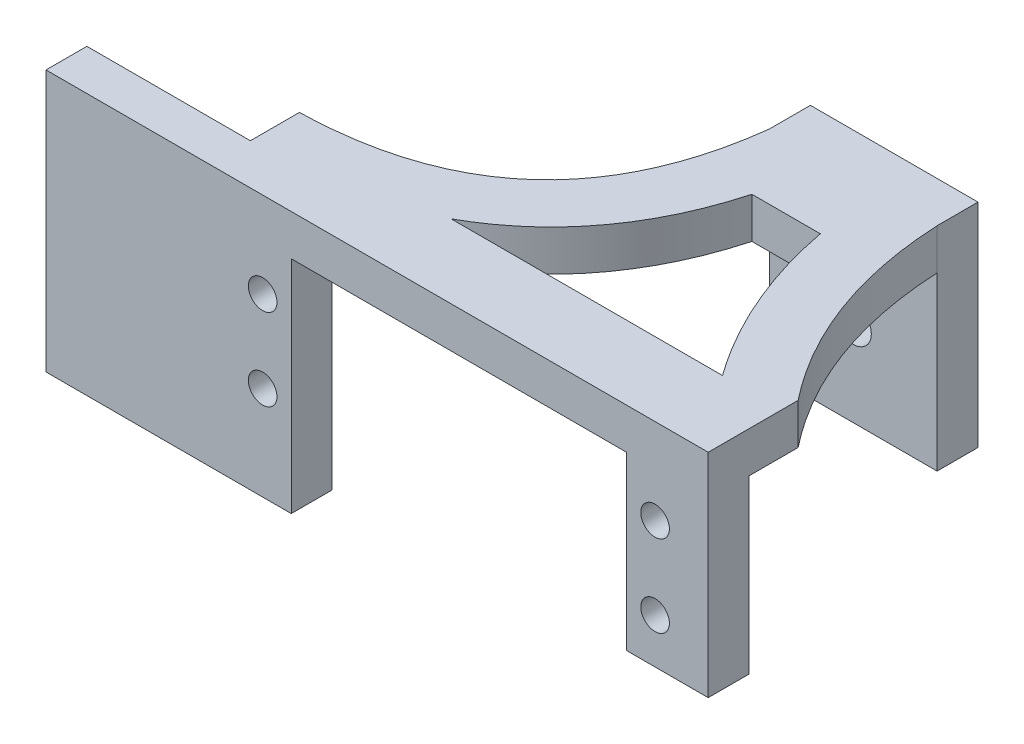
from build123d import *

# Parameters (mm, degrees)
SKETCH1_W             = 10
SKETCH1_H             = 5
BOSS_EXTRUDE1_DEPTH   = 21
BOSS_EXTRUDE1_2_DEPTH = 21
SKETCH2_W             = 61
SKETCH2_H             = 43
BOSS_EXTRUDE2_DEPTH   = 5
SKETCH3_W             = 20.5
SKETCH3_H             = 5
BOSS_EXTRUDE3_DEPTH   = 21
CUT_EXTRUDE1_REACH    = 74.498
SKETCH4_R             = 2.2
CUT_EXTRUDE2_REACH    = 77.24
SKETCH5_R             = 1.75
CUT_EXTRUDE4_START    = -5
CUT_EXTRUDE4_DEPTH    = 5
SKETCH11_W            = 5
SKETCH11_H            = 32
BOSS_EXTRUDE5_DEPTH   = 20
SKETCH14_W            = 10
SKETCH14_H            = 5
BOSS_EXTRUDE6_DEPTH   = 6


# Read off the part's stored shape, not the designer's step: Cut-Extrude4
with BuildPart() as part:
    # Sketch1 → Boss-Extrude1 (new body)
    with BuildSketch(Plane(origin=(0, 0, 0), x_dir=(1, 0, 0), z_dir=(0, 1, 0))):
        Rectangle(SKETCH1_W, SKETCH1_H)
    extrude(amount=BOSS_EXTRUDE1_DEPTH)



with BuildPart() as body_2:
    # Sketch1 → Boss-Extrude1 2 (new body)
    with BuildSketch(Plane(origin=(0, 0, 0), x_dir=(1, 0, 0), z_dir=(0, 1, 0))):
        with Locations((51, 0)):
            Rectangle(SKETCH1_W, SKETCH1_H)
    extrude(amount=BOSS_EXTRUDE1_2_DEPTH)


with BuildPart() as part_1:
    add(part.part)

    add(body_2.part)  # Boss-Extrude2 merges body 2
    # Sketch2 → Boss-Extrude2 (add)
    with BuildSketch(Plane(origin=(0, 21, 0), x_dir=(1, 0, 0), z_dir=(0, 1, 0))):
        with Locations((25.5, 19)):
            Rectangle(SKETCH2_W, SKETCH2_H)
    extrude(amount=BOSS_EXTRUDE2_DEPTH)

    # Sketch3 → Boss-Extrude3 (add)
    with BuildSketch(Plane.XZ.offset(-21)):
        with Locations((35.75, -38)):
            Rectangle(SKETCH3_W, SKETCH3_H)
    extrude(amount=BOSS_EXTRUDE3_DEPTH)

    # Sketch4 → Cut-Extrude1 (cut, up to next)
    with BuildSketch(Plane.XY.offset(-35.5), mode=Mode.PRIVATE) as cut_extrude1_sk1:
        with Locations((35.75, 10.5)):
            Circle(SKETCH4_R)
    cut_extrude1_tool1 = extrude(cut_extrude1_sk1.sketch, amount=-CUT_EXTRUDE1_REACH, mode=Mode.PRIVATE) & part_1.part
    add(cut_extrude1_tool1.solids().sort_by_distance((35.75, 10.5, -35.5))[0], mode=Mode.SUBTRACT)

    # Sketch5 → Cut-Extrude2 (cut, up to next)
    with BuildSketch(Plane.XY.offset(2.5), mode=Mode.PRIVATE) as cut_extrude2_sk1:
        with Locations((1.5, 15.5)):
            Circle(SKETCH5_R)
    cut_extrude2_tool1 = extrude(cut_extrude2_sk1.sketch, amount=-CUT_EXTRUDE2_REACH, mode=Mode.PRIVATE) & part_1.part
    # Sketch5 → Cut-Extrude2 (cut, up to next)
    with BuildSketch(Plane.XY.offset(2.5), mode=Mode.PRIVATE) as cut_extrude2_sk2:
        with Locations((49.5, 15.5)):
            Circle(SKETCH5_R)
    cut_extrude2_tool2 = extrude(cut_extrude2_sk2.sketch, amount=-CUT_EXTRUDE2_REACH, mode=Mode.PRIVATE) & part_1.part
    # Sketch5 → Cut-Extrude2 (cut, up to next)
    with BuildSketch(Plane.XY.offset(2.5), mode=Mode.PRIVATE) as cut_extrude2_sk3:
        with Locations((49.5, 5.5)):
            Circle(SKETCH5_R)
    cut_extrude2_tool3 = extrude(cut_extrude2_sk3.sketch, amount=-CUT_EXTRUDE2_REACH, mode=Mode.PRIVATE) & part_1.part
    # Sketch5 → Cut-Extrude2 (cut, up to next)
    with BuildSketch(Plane.XY.offset(2.5), mode=Mode.PRIVATE) as cut_extrude2_sk4:
        with Locations((1.5, 5.5)):
            Circle(SKETCH5_R)
    cut_extrude2_tool4 = extrude(cut_extrude2_sk4.sketch, amount=-CUT_EXTRUDE2_REACH, mode=Mode.PRIVATE) & part_1.part
    add(cut_extrude2_tool1.solids().sort_by_distance((1.5, 15.5, 2.5))[0], mode=Mode.SUBTRACT)
    add(cut_extrude2_tool2.solids().sort_by_distance((49.5, 15.5, 2.5))[0], mode=Mode.SUBTRACT)
    add(cut_extrude2_tool3.solids().sort_by_distance((49.5, 5.5, 2.5))[0], mode=Mode.SUBTRACT)
    add(cut_extrude2_tool4.solids().sort_by_distance((1.5, 5.5, 2.5))[0], mode=Mode.SUBTRACT)

    # Cut-Extrude4 outline → Cut-Extrude4 (cut)
    with BuildSketch(Plane.XZ.offset(-21).offset(CUT_EXTRUDE4_START)):
        with BuildLine():
            Line((25.5, -40.5), (25.5, -35.5))
            add(Edge.make_bspline(
                [(25.5, -35.5), (22.307194013, -9.111827573), (-5, -8.5)],
                knots=[0, 0, 0, 1, 1, 1], degree=2))
            Line((-5, -8.5), (-5, -40.5))
            Line((-5, -40.5), (25.5, -40.5))
        make_face()
        with BuildLine():
            Line((46, -35.5), (46, -40.5))
            Line((46, -40.5), (56, -40.5))
            Line((56, -40.5), (56, -8.5))
            add(Edge.make_bspline(
                [(46, -35.5), (46.761539252, -20.151458346), (56, -8.5)],
                knots=[0, 0, 0, 1, 1, 1], degree=2))
        make_face()
        with BuildLine():
            add(Edge.make_bspline(
                [(31.343896349, -27.5), (31.33756892, -27.477004827), (30.705752309, -25.187905516), (29.116883998, -20.825539694), (25.674792213, -15.02454609), (21.148134772, -10.119526716), (17.495807629, -7.576251466), (15.551950813, -6.5)],
                knots=[0.123732118, 0.123732118, 0.123732118, 0.123732118, 0.125, 0.25, 0.375, 0.5, 0.624358146, 0.624358146, 0.624358146, 0.624358146], degree=3))
            Line((31.343896349, -27.5), (39.715207905, -27.5))
            add(Edge.make_bspline(
                [(39.715207905, -27.5), (39.769177374, -27.217759906), (40.375135311, -24.177689148), (42.00944543, -18.53264277), (44.988088874, -12.248553286), (47.445071003, -8.34732733), (48.500497039, -6.84736316), (48.751036225, -6.5)],
                knots=[0.224487405, 0.224487405, 0.224487405, 0.224487405, 0.25, 0.5, 0.75, 0.875, 0.913034357, 0.913034357, 0.913034357, 0.913034357], degree=3))
            Line((48.751036225, -6.5), (15.551950813, -6.5))
        make_face()
    extrude(amount=CUT_EXTRUDE4_DEPTH, mode=Mode.SUBTRACT)

    # Sketch11 → Boss-Extrude5 (add)
    with BuildSketch(Plane.ZY.offset(5)):
        with Locations((0, 10)):
            Rectangle(SKETCH11_W, SKETCH11_H)
    extrude(amount=BOSS_EXTRUDE5_DEPTH)

    # Sketch14 → Boss-Extrude6 (add)
    with BuildSketch(Plane.XZ):
        Rectangle(SKETCH14_W, SKETCH14_H)
    extrude(amount=BOSS_EXTRUDE6_DEPTH)


solid = part_1.part
